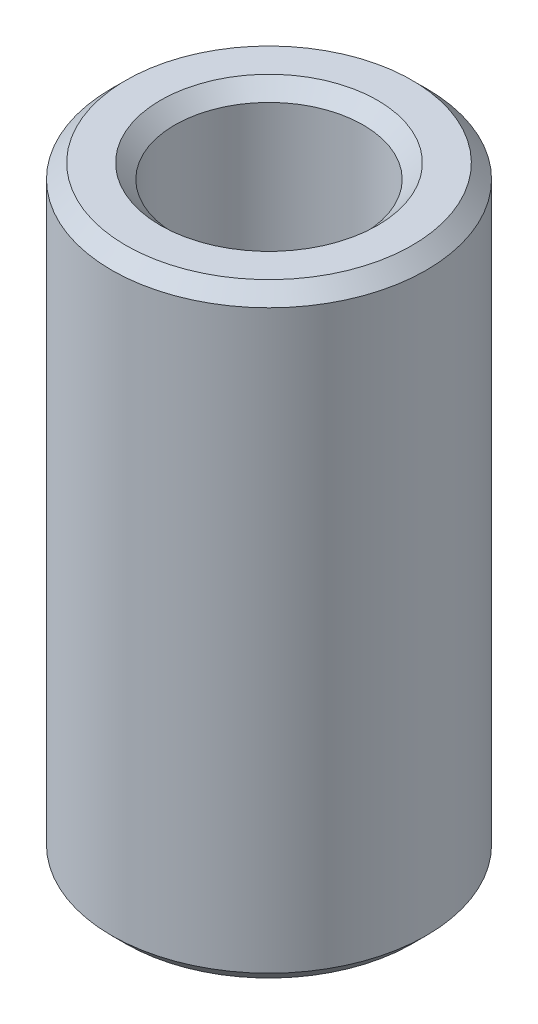
from build123d import *

# Parameters (mm, degrees)
SKETCH1_R           = 15
BOSS_EXTRUDE1_DEPTH = 57.651700471
SKETCH2_R           = 8.980148765
CUT_EXTRUDE1_DEPTH  = 62.4305996
CHAMFER1_SIZE       = 1.360933458


with BuildPart() as part:
    # Sketch1 → Boss-Extrude1 (new body)
    with BuildSketch(Plane(origin=(0, 0, 0), x_dir=(1, 0, 0), z_dir=(0, 1, 0))):
        Circle(SKETCH1_R)
    extrude(amount=BOSS_EXTRUDE1_DEPTH)

    # Sketch2 → Cut-Extrude1 (cut, through all)
    with BuildSketch(Plane(origin=(0, 0, 0), x_dir=(1, 0, 0), z_dir=(0, 1, 0))):
        Circle(SKETCH2_R)
    extrude(amount=CUT_EXTRUDE1_DEPTH, mode=Mode.SUBTRACT)

    # Chamfer1
    chamfer1_edges = [part.edges().sort_by_distance(p)[0] for p in [
        (-8.980148765, 57.651700471, 0),
        (-8.980148765, 0, 0),
        (-15, 0, 0),
        (-15, 57.651700471, 0),
    ]]
    chamfer(chamfer1_edges, length=CHAMFER1_SIZE)


solid = part.part
